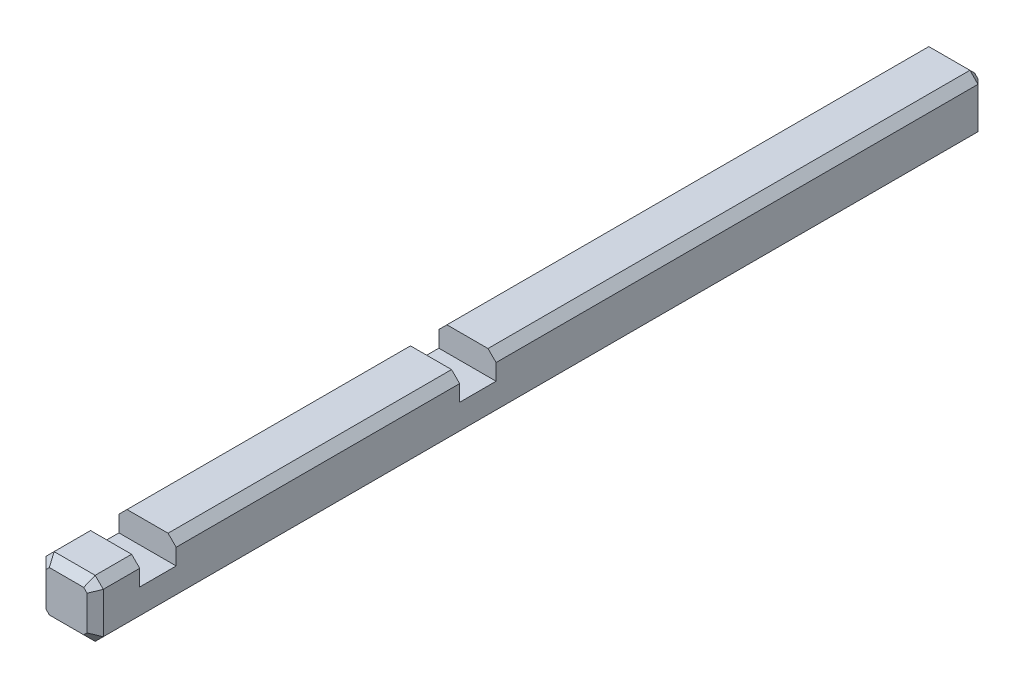
from build123d import *

# Parameters (mm, degrees)
SKETCH1_W           = 7.071067812
SKETCH1_H           = 7.071067812
BOSS_EXTRUDE1_DEPTH = 110
CHAMFER2_SIZE       = 1
SKETCH3_W           = 7.071067812
SKETCH3_H           = 3
CUT_EXTRUDE1_DEPTH  = 4.5
SKETCH4_W           = 7.071067812
SKETCH4_H           = 3
CUT_EXTRUDE2_DEPTH  = 4.5
CHAMFER3_SIZE       = 1


with BuildPart() as part:
    # Sketch1 → Boss-Extrude1 (new body)
    with BuildSketch(Plane.XY):
        Rectangle(SKETCH1_W, SKETCH1_H)
    extrude(amount=BOSS_EXTRUDE1_DEPTH)

    # Chamfer2
    chamfer2_edges = [part.edges().sort_by_distance(p)[0] for p in [
        (3.535533906, -3.535533906, 55),
        (-3.535533906, -3.535533906, 55),
        (3.535533906, 3.535533906, 55),
        (-3.535533906, 3.535533906, 55),
    ]]
    chamfer(chamfer2_edges, length=CHAMFER2_SIZE)

    # Sketch3 → Cut-Extrude1 (cut)
    with BuildSketch(Plane(origin=(0, 0, 65), x_dir=(-1, 0, 0), z_dir=(0, 0, -1))):
        with Locations((0, 2.035533906)):
            Rectangle(SKETCH3_W, SKETCH3_H)
    extrude(amount=CUT_EXTRUDE1_DEPTH, mode=Mode.SUBTRACT)

    # Sketch4 → Cut-Extrude2 (cut)
    with BuildSketch(Plane(origin=(0, 0, 104.5), x_dir=(-1, 0, 0), z_dir=(0, 0, -1))):
        with Locations((0, 2.035533906)):
            Rectangle(SKETCH4_W, SKETCH4_H)
    extrude(amount=CUT_EXTRUDE2_DEPTH, mode=Mode.SUBTRACT)

    # Chamfer3
    chamfer3_edges = [part.edges().sort_by_distance(p)[0] for p in [
        (3.035533906, 3.035533906, 0),
        (0, 3.535533906, 0),
        (-3.035533906, 3.035533906, 0),
        (-3.535533906, 0, 0),
        (-3.035533906, -3.035533906, 0),
        (0, -3.535533906, 0),
        (3.035533906, -3.035533906, 0),
        (3.535533906, 0, 0),
        (-3.035533906, -3.035533906, 110),
        (-3.535533906, 0, 110),
        (-3.035533906, 3.035533906, 110),
        (0, 3.535533906, 110),
        (3.035533906, 3.035533906, 110),
        (3.535533906, 0, 110),
        (3.035533906, -3.035533906, 110),
        (0, -3.535533906, 110),
    ]]
    chamfer(chamfer3_edges, length=CHAMFER3_SIZE)


solid = part.part
